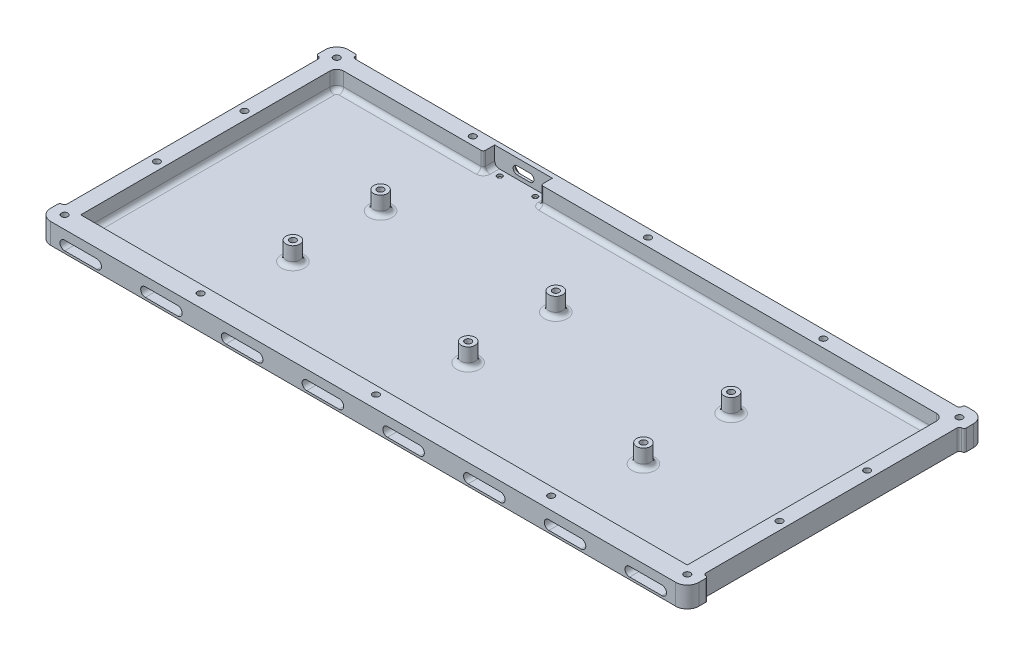
from build123d import *

# Parameters (mm, degrees)
SKETCH1_W               = 281
SKETCH1_H               = 129
BOSS_EXTRUDE1_DEPTH     = 1
SKETCH2_W               = 281
SKETCH2_H               = 129
SKETCH2_W_2             = 263
SKETCH2_H_2             = 111
BOSS_EXTRUDE2_DEPTH     = 8
CUT_EXTRUDE1_REACH      = 156.86
SKETCH3_R               = 1.4
SKETCH16_R              = 3
SKETCH16_R_2            = 1.4
BOSS_EXTRUDE7_DEPTH     = 8
LPATTERN1_OUTLINE_R     = 1.4
LPATTERN1_DEPTH         = 9
LPATTERN1_START         = 1
LPATTERN1_2_OUTLINE_R   = 3
LPATTERN1_2_OUTLINE_R_2 = 1.4
LPATTERN1_2_DEPTH       = 8
CUT_EXTRUDE7_REACH      = 156.86
SKETCH18_W              = 2
SKETCH18_H              = 111
CUT_EXTRUDE9_REACH      = 156.86
SKETCH19_W              = 263
SKETCH19_H              = 2
FILLET8_R               = 1
SKETCH10_W              = 25
SKETCH10_H              = 5
CUT_EXTRUDE3_DEPTH      = 8
CUT_EXTRUDE4_REACH      = 190.272
CUT_EXTRUDE5_START      = -3
CUT_EXTRUDE5_DEPTH      = 1
FILLET5_R               = 1
CUT_EXTRUDE8_REACH      = 156.805
SKETCH17_R              = 1.1
FILLET1_R               = 5
FILLET2_R               = 3
CUT_EXTRUDE2_REACH      = 186.99
LPATTERN2_COUNT         = 8
LPATTERN2_PITCH         = 35
FILLET7_R               = 1
FILLET9_R               = 2


# Read off the part's stored shape, not the designer's step: LPattern1
with BuildPart() as part:
    # Sketch1 → Boss-Extrude1 (new body)
    with BuildSketch(Plane(origin=(0, 0, 0), x_dir=(1, 0, 0), z_dir=(0, 1, 0))):
        Rectangle(SKETCH1_W, SKETCH1_H)
    extrude(amount=BOSS_EXTRUDE1_DEPTH)

    # Sketch2 → Boss-Extrude2 (add)
    with BuildSketch(Plane(origin=(0, 1, 0), x_dir=(1, 0, 0), z_dir=(0, 1, 0))):
        Rectangle(SKETCH2_W, SKETCH2_H)
        Rectangle(SKETCH2_W_2, SKETCH2_H_2, mode=Mode.SUBTRACT)
    extrude(amount=BOSS_EXTRUDE2_DEPTH)

    # Sketch3 → Cut-Extrude1 (cut, up to next)
    with BuildSketch(Plane(origin=(0, 0, 0), x_dir=(1, 0, 0), z_dir=(0, 1, 0)), mode=Mode.PRIVATE) as cut_extrude1_sk1:
        with Locations(Location((-135, 59, 0), (0, 0, 270))):
            Circle(SKETCH3_R)
    cut_extrude1_tool1 = extrude(cut_extrude1_sk1.sketch, amount=CUT_EXTRUDE1_REACH, mode=Mode.PRIVATE) & part.part
    add(cut_extrude1_tool1.solids().sort_by_distance((-135, 0, -59))[0], mode=Mode.SUBTRACT)

    # Sketch16 → Boss-Extrude7 (add)
    with BuildSketch(Plane(origin=(0, 1, 0), x_dir=(1, 0, 0), z_dir=(0, 1, 0))):
        with Locations((-135, 59)):
            Circle(SKETCH16_R)
        with Locations(Location((-135, 59, 0), (0, 0, 270))):
            Circle(SKETCH16_R_2, mode=Mode.SUBTRACT)
    extrude(amount=BOSS_EXTRUDE7_DEPTH)

    # LPattern1 outline → LPattern1 (cut)
    with BuildSketch(Plane(origin=(0, 0, 0), x_dir=(1, 0, 0), z_dir=(0, 1, 0))):
        with Locations((0, 19)):
            Circle(LPATTERN1_OUTLINE_R)
        with Locations((-76, -19)):
            Circle(LPATTERN1_OUTLINE_R)
        with Locations((-76, 19)):
            Circle(LPATTERN1_OUTLINE_R)
        with Locations((76, -19)):
            Circle(LPATTERN1_OUTLINE_R)
        with Locations((76, 19)):
            Circle(LPATTERN1_OUTLINE_R)
        with Locations((0, -19)):
            Circle(LPATTERN1_OUTLINE_R)
        with Locations((-135, 19)):
            Circle(LPATTERN1_OUTLINE_R)
        with Locations((135, -59)):
            Circle(LPATTERN1_OUTLINE_R)
        with Locations((135, -19)):
            Circle(LPATTERN1_OUTLINE_R)
        with Locations((0, 59)):
            Circle(LPATTERN1_OUTLINE_R)
        with Locations((-76, -59)):
            Circle(LPATTERN1_OUTLINE_R)
        with Locations((-76, 59)):
            Circle(LPATTERN1_OUTLINE_R)
        with Locations((-135, -59)):
            Circle(LPATTERN1_OUTLINE_R)
        with Locations((-135, -19)):
            Circle(LPATTERN1_OUTLINE_R)
        with Locations((135, 19)):
            Circle(LPATTERN1_OUTLINE_R)
        with Locations((135, 59)):
            Circle(LPATTERN1_OUTLINE_R)
        with Locations((76, -59)):
            Circle(LPATTERN1_OUTLINE_R)
        with Locations((76, 59)):
            Circle(LPATTERN1_OUTLINE_R)
        with Locations((0, -59)):
            Circle(LPATTERN1_OUTLINE_R)
    extrude(amount=LPATTERN1_DEPTH, mode=Mode.SUBTRACT)

    # LPattern1 2 outline → LPattern1 2 (add)
    # profile 1 of 6: a face of its own
    with BuildSketch(Plane(origin=(0, 0, 0), x_dir=(1, 0, 0), z_dir=(0, 1, 0)).offset(LPATTERN1_START)):
        with Locations((-76, 19)):
            Circle(LPATTERN1_2_OUTLINE_R)
        with Locations((-76, 19)):
            Circle(LPATTERN1_2_OUTLINE_R_2, mode=Mode.SUBTRACT)
    # profile 2 of 6: a face of its own
    with BuildSketch(Plane(origin=(0, 0, 0), x_dir=(1, 0, 0), z_dir=(0, 1, 0)).offset(LPATTERN1_START)):
        with Locations((-76, -19)):
            Circle(LPATTERN1_2_OUTLINE_R)
        with Locations((-76, -19)):
            Circle(LPATTERN1_2_OUTLINE_R_2, mode=Mode.SUBTRACT)
    # profile 3 of 6: a face of its own
    with BuildSketch(Plane(origin=(0, 0, 0), x_dir=(1, 0, 0), z_dir=(0, 1, 0)).offset(LPATTERN1_START)):
        with Locations((0, 19)):
            Circle(LPATTERN1_2_OUTLINE_R)
        with Locations((0, 19)):
            Circle(LPATTERN1_2_OUTLINE_R_2, mode=Mode.SUBTRACT)
    # profile 4 of 6: a face of its own
    with BuildSketch(Plane(origin=(0, 0, 0), x_dir=(1, 0, 0), z_dir=(0, 1, 0)).offset(LPATTERN1_START)):
        with Locations((0, -19)):
            Circle(LPATTERN1_2_OUTLINE_R)
        with Locations((0, -19)):
            Circle(LPATTERN1_2_OUTLINE_R_2, mode=Mode.SUBTRACT)
    # profile 5 of 6: a face of its own
    with BuildSketch(Plane(origin=(0, 0, 0), x_dir=(1, 0, 0), z_dir=(0, 1, 0)).offset(LPATTERN1_START)):
        with Locations((76, 19)):
            Circle(LPATTERN1_2_OUTLINE_R)
        with Locations((76, 19)):
            Circle(LPATTERN1_2_OUTLINE_R_2, mode=Mode.SUBTRACT)
    # profile 6 of 6: a face of its own
    with BuildSketch(Plane(origin=(0, 0, 0), x_dir=(1, 0, 0), z_dir=(0, 1, 0)).offset(LPATTERN1_START)):
        with Locations((76, -19)):
            Circle(LPATTERN1_2_OUTLINE_R)
        with Locations((76, -19)):
            Circle(LPATTERN1_2_OUTLINE_R_2, mode=Mode.SUBTRACT)
    extrude(amount=LPATTERN1_2_DEPTH)

    # Sketch18 → Cut-Extrude7 (cut, up to next)
    with BuildSketch(Plane(origin=(0, 0, 0), x_dir=(1, 0, 0), z_dir=(0, 1, 0)), mode=Mode.PRIVATE) as cut_extrude7_sk1:
        with Locations((-139.5, 0)):
            Rectangle(SKETCH18_W, SKETCH18_H)
    cut_extrude7_tool1 = extrude(cut_extrude7_sk1.sketch, amount=CUT_EXTRUDE7_REACH, mode=Mode.PRIVATE) & part.part
    cut_extrude7 = cut_extrude7_tool1.solids().sort_by_distance((-139.5, 0, 0))[0]
    add(cut_extrude7, mode=Mode.SUBTRACT)

    # Mirror1: Cut-Extrude7 across plane
    add(cut_extrude7.mirror(Plane(origin=(0, 0, 0), x_dir=(0, 0, 1), z_dir=(1, 0, 0))), mode=Mode.SUBTRACT)

    # Sketch19 → Cut-Extrude9 (cut, up to next)
    with BuildSketch(Plane(origin=(0, 0, 0), x_dir=(1, 0, 0), z_dir=(0, 1, 0)), mode=Mode.PRIVATE) as cut_extrude9_sk1:
        with Locations((0, 63.5)):
            Rectangle(SKETCH19_W, SKETCH19_H)
    cut_extrude9_tool1 = extrude(cut_extrude9_sk1.sketch, amount=CUT_EXTRUDE9_REACH, mode=Mode.PRIVATE) & part.part
    add(cut_extrude9_tool1.solids().sort_by_distance((0, 0, -63.5))[0], mode=Mode.SUBTRACT)

    # Fillet8
    fillet8_edges = [part.edges().sort_by_distance(p)[0] for p in [
        (-138.5, 4.5, -55.5),
        (138.5, 4.5, 55.5),
        (138.5, 4.5, -55.5),
        (-138.5, 4.5, 55.5),
        (131.5, 4.5, -62.5),
        (-131.5, 4.5, -62.5),
    ]]
    fillet(fillet8_edges, radius=FILLET8_R)
    fillet8_2_edges = [part.edges().sort_by_distance(p)[0] for p in [
        (-140.5, 4.5, -55.5),
        (140.5, 4.5, 55.5),
        (140.5, 4.5, -55.5),
        (-140.5, 4.5, 55.5),
        (131.5, 4.5, -64.5),
        (-131.5, 4.5, -64.5),
    ]]
    fillet(fillet8_2_edges, radius=FILLET8_R - 0.0001)  # a hair under: the kernel refuses the full size

    # Sketch10 → Cut-Extrude3 (cut)
    with BuildSketch(Plane(origin=(0, 9, 0), x_dir=(1, 0, 0), z_dir=(0, 1, 0))):
        with Locations((-55.5, 58)):
            Rectangle(SKETCH10_W, SKETCH10_H)
    extrude(amount=-CUT_EXTRUDE3_DEPTH, mode=Mode.SUBTRACT)

    # Sketch13 → Cut-Extrude4 (cut, up to next)
    with BuildSketch(Plane.XY.offset(-60.5), mode=Mode.PRIVATE) as cut_extrude4_sk1:
        with BuildLine():
            Line((-58.3, 6.025), (-52.7, 6.025))
            ThreePointArc((-52.7, 6.025), (-51, 4.325), (-52.7, 2.625))
            Line((-52.7, 2.625), (-58.3, 2.625))
            ThreePointArc((-58.3, 2.625), (-60, 4.325), (-58.3, 6.025))
        make_face()
    cut_extrude4_tool1 = extrude(cut_extrude4_sk1.sketch, amount=-CUT_EXTRUDE4_REACH, mode=Mode.PRIVATE) & part.part
    add(cut_extrude4_tool1.solids().sort_by_distance((-55.5, 4.325, -60.5))[0], mode=Mode.SUBTRACT)

    # Sketch15 → Cut-Extrude5 (cut)
    with BuildSketch(Plane(origin=(0, 0, -64.5), x_dir=(-1, 0, 0), z_dir=(0, 0, -1)).offset(CUT_EXTRUDE5_START)):
        with BuildLine():
            Line((52.7, 1.625), (58.3, 1.625))
            ThreePointArc((58.3, 1.625), (61, 4.325), (58.3, 7.025))
            Line((58.3, 7.025), (52.7, 7.025))
            ThreePointArc((52.7, 7.025), (50, 4.325), (52.7, 1.625))
        make_face()
        with BuildLine():
            Line((52.7, 2.625), (58.3, 2.625))
            ThreePointArc((58.3, 2.625), (60, 4.325), (58.3, 6.025))
            Line((58.3, 6.025), (52.7, 6.025))
            ThreePointArc((52.7, 6.025), (51, 4.325), (52.7, 2.625))
        make_face(mode=Mode.SUBTRACT)
    extrude(amount=CUT_EXTRUDE5_DEPTH, mode=Mode.SUBTRACT)

    # Fillet5
    fillet5_edges = [part.edges().sort_by_distance(p)[0] for p in [
        (-50, 4.325, -61.5),
        (-55.5, 7.025, -61.5),
        (-61, 4.325, -61.5),
        (-55.5, 1.625, -61.5),
    ]]
    fillet(fillet5_edges, radius=FILLET5_R - 0.0001)  # a hair under: the kernel refuses the full size

    # Sketch17 → Cut-Extrude8 (cut, up to next)
    with BuildSketch(Plane(origin=(0, 1, 0), x_dir=(1, 0, 0), z_dir=(0, 1, 0)), mode=Mode.PRIVATE) as cut_extrude8_sk1:
        with Locations(Location((-47.8, 57.9, 0), (0, 0, 270))):
            Circle(SKETCH17_R)
    cut_extrude8_tool1 = extrude(cut_extrude8_sk1.sketch, amount=-CUT_EXTRUDE8_REACH, mode=Mode.PRIVATE) & part.part
    # Sketch17 → Cut-Extrude8 (cut, up to next)
    with BuildSketch(Plane(origin=(0, 1, 0), x_dir=(1, 0, 0), z_dir=(0, 1, 0)), mode=Mode.PRIVATE) as cut_extrude8_sk2:
        with Locations(Location((-63.2, 57.9, 0), (0, 0, 270))):
            Circle(SKETCH17_R)
    cut_extrude8_tool2 = extrude(cut_extrude8_sk2.sketch, amount=-CUT_EXTRUDE8_REACH, mode=Mode.PRIVATE) & part.part
    add(cut_extrude8_tool1.solids().sort_by_distance((-47.8, 1, -57.9))[0], mode=Mode.SUBTRACT)
    add(cut_extrude8_tool2.solids().sort_by_distance((-63.2, 1, -57.9))[0], mode=Mode.SUBTRACT)

    # Fillet1
    fillet1_edges = [part.edges().sort_by_distance(p)[0] for p in [
        (-140.5, 4.5, 64.5),
        (140.5, 4.5, 64.5),
        (140.5, 4.5, -64.5),
        (-140.5, 4.5, -64.5),
    ]]
    fillet(fillet1_edges, radius=FILLET1_R)

    # Fillet2
    fillet2_edges = [part.edges().sort_by_distance(p)[0] for p in [
        (131.5, 5, -55.5),
        (-131.5, 5, -55.5),
    ]]
    fillet(fillet2_edges, radius=FILLET2_R)

    # Sketch7 → Cut-Extrude2 (cut, up to next)
    with BuildSketch(Plane(origin=(0, 0, 55.5), x_dir=(-1, 0, 0), z_dir=(0, 0, -1)), mode=Mode.PRIVATE) as cut_extrude2_sk1:
        with BuildLine():
            Line((129.5, 1), (115.5, 1))
            ThreePointArc((115.5, 1), (113.5, 3), (115.5, 5))
            Line((115.5, 5), (129.5, 5))
            ThreePointArc((129.5, 5), (131.5, 3), (129.5, 1))
        make_face()
    cut_extrude2_tool1 = extrude(cut_extrude2_sk1.sketch, amount=-CUT_EXTRUDE2_REACH, mode=Mode.PRIVATE) & part.part
    cut_extrude2 = cut_extrude2_tool1.solids().sort_by_distance((-122.5, 3, 55.5))[0]
    add(cut_extrude2, mode=Mode.SUBTRACT)

    # LPattern2: Cut-Extrude2 ×8
    with Locations(*[(i * LPATTERN2_PITCH, 0, 0) for i in range(1, LPATTERN2_COUNT)]):
        add(cut_extrude2, mode=Mode.SUBTRACT)

    # Fillet7
    fillet7_edges = [part.edges().sort_by_distance(p)[0] for p in [
        (-68, 5, -55.5),
        (-43, 5, -55.5),
    ]]
    fillet(fillet7_edges, radius=FILLET7_R)

    # Fillet9
    fillet9_edges = [part.edges().sort_by_distance(p)[0] for p in [
        (-43, 1, -58.5),
        (-42.707106781, 1, -55.792893219),
        (43.25, 1, -55.5),
        (130.621320344, 1, -54.621320344),
        (-68, 1, -58.5),
        (-68.292893219, 1, -55.792893219),
        (-98.75, 1, -55.5),
        (-130.621320344, 1, -54.621320344),
        (-79, 1, -19),
        (-79, 1, 19),
        (-3, 1, 19),
        (-3, 1, -19),
        (73, 1, -19),
        (73, 1, 19),
        (131.5, 1, 1.5),
        (-131.5, 1, 1.5),
    ]]
    fillet(fillet9_edges, radius=FILLET9_R)


solid = part.part
